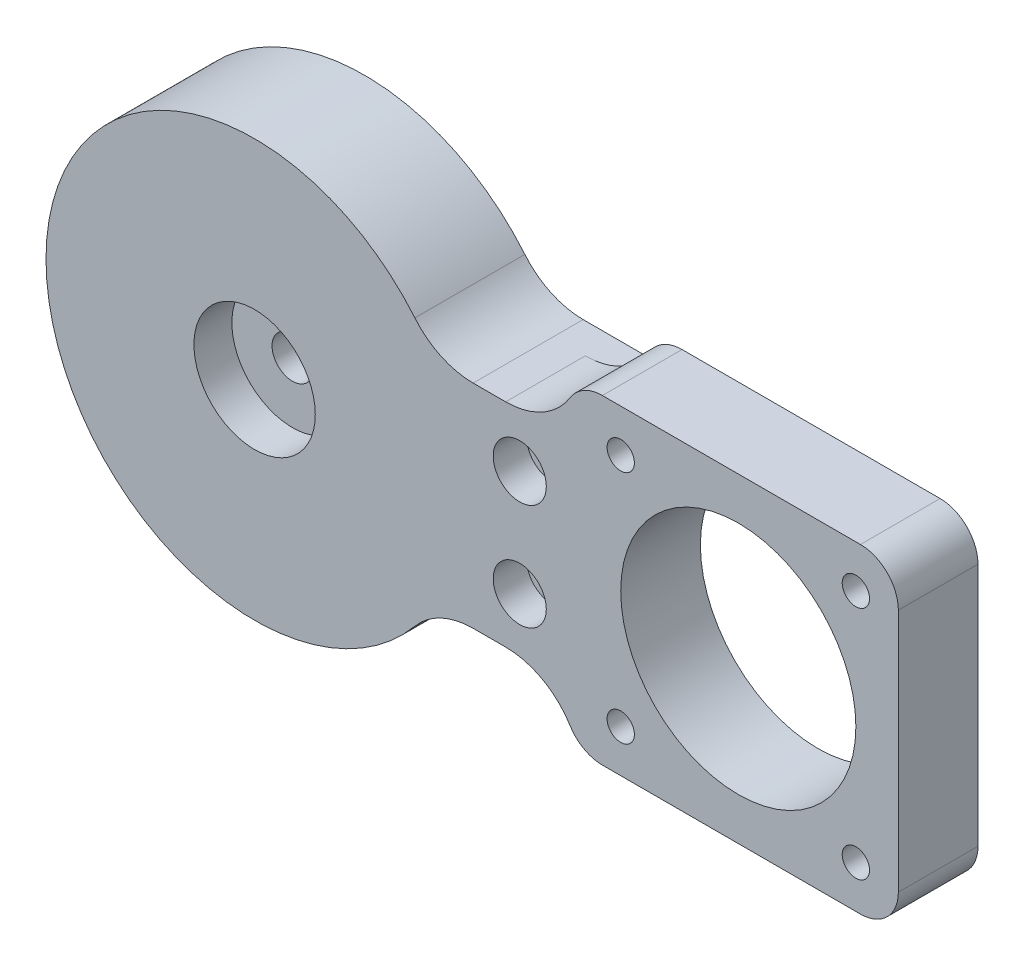
from build123d import *

# Parameters (mm, degrees)
SKETCH1_R                                            = 15.5
SKETCH1_R_2                                          = 1.5
SKETCH1_R_3                                          = 2.7
BOSS_EXTRUDE1_DEPTH                                  = 14.5
SKETCH2_W                                            = 42.2
SKETCH2_H                                            = 42.2
CUT_EXTRUDE1_DEPTH                                   = 4
SKETCH3_R                                            = 8
CUT_EXTRUDE2_DEPTH                                   = 5
FILLET2_R                                            = 10
TALADRO_DE_MARGEN_PARA_M31_D                         = 3.6
SKETCH7_R                                            = 1.5
CUT_EXTRUDE3_DEPTH                                   = 91.38445183
REFRENTADO_PARA_TORNILLO_CON_CABEZA_TRON_D           = 3.6
REFRENTADO_PARA_TORNILLO_CON_CABEZA_TRON_CBORE_D     = 7
REFRENTADO_PARA_TORNILLO_CON_CABEZA_TRON_CBORE_DEPTH = 4.4
FILLET3_R                                            = 5


with BuildPart() as part:
    # Sketch1 → Boss-Extrude1 (new body)
    with BuildSketch(Plane.XY):
        with BuildLine():
            Line((42.669600757, 14), (42.669600757, 21.1))
            Line((42.669600757, 21.1), (84.869600757, 21.1))
            Line((84.869600757, 21.1), (84.869600757, -21.1))
            Line((84.869600757, -21.1), (42.669600757, -21.1))
            Line((42.669600757, -21.1), (42.669600757, -14))
            Line((42.669600757, -14), (23.669600757, -14))
            ThreePointArc((23.669600757, -14), (-27.5, 0), (23.669600757, 14))
            Line((23.669600757, 14), (42.669600757, 14))
        make_face()
        with Locations(Location((63.769600757, 0, 0), (0, 0, 180))):
            Circle(SKETCH1_R, mode=Mode.SUBTRACT)
        with Locations(Location((48.269600757, 15.5, 0), (0, 0, 180))):
            Circle(SKETCH1_R_2, mode=Mode.SUBTRACT)
        with Locations(Location((79.269600757, 15.5, 0), (0, 0, 180))):
            Circle(SKETCH1_R_2, mode=Mode.SUBTRACT)
        with Locations(Location((79.269600757, -15.5, 0), (0, 0, 180))):
            Circle(SKETCH1_R_2, mode=Mode.SUBTRACT)
        with Locations(Location((48.269600757, -15.5, 0), (0, 0, 180))):
            Circle(SKETCH1_R_2, mode=Mode.SUBTRACT)
        with Locations(Location((0, 0, 0), (0, 0, 180))):
            Circle(SKETCH1_R_3, mode=Mode.SUBTRACT)
    extrude(amount=BOSS_EXTRUDE1_DEPTH)

    # Sketch2 → Cut-Extrude1 (cut)
    with BuildSketch(Plane(origin=(0, 0, 0), x_dir=(-1, 0, 0), z_dir=(0, 0, -1))):
        with Locations((-63.769600757, 0)):
            Rectangle(SKETCH2_W, SKETCH2_H)
    extrude(amount=-CUT_EXTRUDE1_DEPTH, mode=Mode.SUBTRACT)

    # Sketch3 → Cut-Extrude2 (cut)
    with BuildSketch(Plane.XY.offset(14.5)):
        Circle(SKETCH3_R)
    extrude(amount=-CUT_EXTRUDE2_DEPTH, mode=Mode.SUBTRACT)

    # Fillet2
    # the kernel refuses this fillet: 10 mm, written as the material it adds along each edge
    with BuildSketch(Plane(origin=(42.669600757, -14, 4), x_dir=(-1, 0, 0), z_dir=(0, 0, 1))) as fillet2_piece_1:
        with BuildLine():
            CenterArc((9.570266454, 10), FILLET2_R, 196.857956022, 73.142043978)
            Line((0, 7.1), (0, 0))
            Line((0, 0), (9.570266454, 0))
        make_face()
    extrude(amount=10.5)
    with BuildSketch(Plane(origin=(42.669600757, 14, 4), x_dir=(-1, 0, 0), z_dir=(0, 0, 1))) as fillet2_piece_2:
        with BuildLine():
            CenterArc((9.570266454, -10), FILLET2_R, 90, 73.142043978)
            Line((0, -7.1), (0, 0))
            Line((0, 0), (9.570266454, 0))
        make_face()
    extrude(amount=10.5)
    with BuildSketch(Plane(origin=(23.669600757, -14, 0), x_dir=(-0.5763974746684583, -0.8171694751982751, 0), z_dir=(0, 0, 1))) as fillet2_piece_3:
        with BuildLine():
            CenterArc((5.206441973, 9.967869045), FILLET2_R, 215.197557054, 50.2081805)
            Line((-2.965252779, 4.203894298), (0, 0))
            ThreePointArc((0, 0), (2.20272545, 0.088360126), (4.4054509, 0))
        make_face()
    extrude(amount=14.5)
    with BuildSketch(Plane(origin=(23.669600757, 14, 0), x_dir=(1, 0, 0), z_dir=(0, 0, 1))) as fillet2_piece_4:
        with BuildLine():
            CenterArc((5.144458311, 10), FILLET2_R, 219.7918195, 50.2081805)
            ThreePointArc((-2.539290774, 3.6), (-1.197440189, 1.850930553), (0, 0))
            Line((0, 0), (5.144458311, 0))
        make_face()
    extrude(amount=14.5)

    # Taladro de margen para M31 (through all)
    with Locations(Plane.XY.offset(14.5)):
        with Locations((79.269600757, -15.5), (79.269600757, 15.5), (48.269600757, 15.5), (48.269600757, -15.5)):
            Hole(TALADRO_DE_MARGEN_PARA_M31_D / 2)

    # Sketch7 → Cut-Extrude3 (cut, through all)
    with BuildSketch(Plane.XY.offset(14.5)):
        with Locations((34.956696686, 7)):
            Circle(SKETCH7_R)
        with Locations((34.956696686, -7)):
            Circle(SKETCH7_R)
    extrude(amount=-CUT_EXTRUDE3_DEPTH, mode=Mode.SUBTRACT)

    # Refrentado para tornillo con cabeza troncocónica de M31 (through all)
    with Locations(Plane.XY.offset(14.5)):
        with Locations((34.956696686, 7), (34.956696686, -7)):
            CounterBoreHole(REFRENTADO_PARA_TORNILLO_CON_CABEZA_TRON_D / 2, REFRENTADO_PARA_TORNILLO_CON_CABEZA_TRON_CBORE_D / 2, REFRENTADO_PARA_TORNILLO_CON_CABEZA_TRON_CBORE_DEPTH)

    # Fillet3
    fillet3_edges = [part.edges().sort_by_distance(p)[0] for p in [
        (84.869600757, -21.1, 9.25),
        (42.669600757, -21.1, 9.25),
        (42.669600757, 21.1, 9.25),
        (84.869600757, 21.1, 9.25),
    ]]
    fillet(fillet3_edges, radius=FILLET3_R)


solid = part.part
